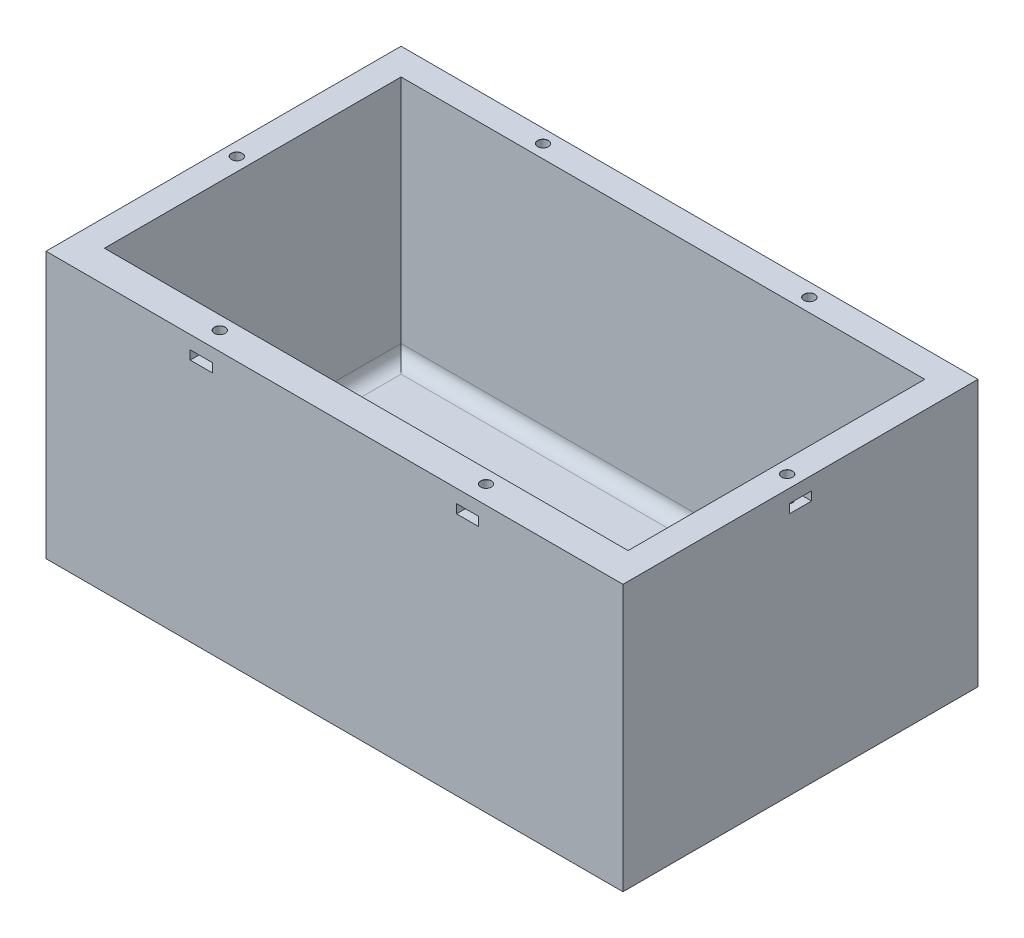
from build123d import *

# Parameters (mm, degrees)
SKIZZE1_W                                  = 130
SKIZZE1_H                                  = 80
AUFSATZ_LINEAR_AUSTRAGEN1_DEPTH            = 60
SKIZZE2_W                                  = 118
SKIZZE2_H                                  = 66.841692054
SCHNITT_LINEAR_AUSTRAGEN1_DEPTH            = 55
SKIZZE3_W                                  = 15.6
SKIZZE3_H                                  = 20
AUFSATZ_LINEAR_AUSTRAGEN2_DEPTH            = 6.8
SCHNITT_LINEAR_START                       = -20
SCHNITT_LINEAR_AUSTRAGEN10_DEPTH           = 20
SCHNITT_LINEAR_AUSTRAGEN11_DEPTH           = 20
SKIZZE16_W                                 = 15.6
SKIZZE16_H                                 = 20
AUFSATZ_LINEAR_AUSTRAGEN3_DEPTH            = 6.8
SCHNITT_LINEAR_AUSTRAGEN12_DEPTH           = 20
SCHNITT_LINEAR_AUSTRAGEN13_DEPTH           = 20
SKIZZE21_W                                 = 30
SKIZZE21_H                                 = 20
SCHNITT_LINEAR_AUSTRAGEN14_DEPTH           = 10
SKIZZE23_W                                 = 3
SKIZZE23_H                                 = 6
SCHNITT_LINEAR_AUSTRAGEN16_DEPTH           = 8
SKIZZE24_W                                 = 3
SKIZZE24_H                                 = 6
SCHNITT_LINEAR_AUSTRAGEN17_DEPTH           = 8
F_3_4_3_4_DURCHMESSER_BOHRUNG2_D           = 3.4
F_3_4_3_4_DURCHMESSER_BOHRUNG2_DEPTH       = 10
F_3_4_3_4_DURCHMESSER_BOHRUNG2_CSINK_D     = 3.45
F_3_4_3_4_DURCHMESSER_BOHRUNG2_CSINK_ANGLE = 90
F_3_4_3_4_DURCHMESSER_BOHRUNG2_TIP         = 1.021463052
F_2_4_2_4_DURCHMESSER_BOHRUNG1_D           = 2.4
F_2_4_2_4_DURCHMESSER_BOHRUNG1_DEPTH       = 10
F_2_4_2_4_DURCHMESSER_BOHRUNG1_CSINK_D     = 2.45
F_2_4_2_4_DURCHMESSER_BOHRUNG1_CSINK_ANGLE = 90
F_2_4_2_4_DURCHMESSER_BOHRUNG1_TIP         = 0.721032743
SKIZZE33_W                                 = 5
SKIZZE33_H                                 = 2
SCHNITT_LINEAR_AUSTRAGEN18_DEPTH           = 5.5
SKIZZE22_W                                 = 30
SKIZZE22_H                                 = 20
SCHNITT_LINEAR_AUSTRAGEN19_DEPTH           = 34.5
F_3_4_3_4_DURCHMESSER_BOHRUNG3_D           = 3.4
F_3_4_3_4_DURCHMESSER_BOHRUNG3_DEPTH       = 10
F_3_4_3_4_DURCHMESSER_BOHRUNG3_CSINK_D     = 3.45
F_3_4_3_4_DURCHMESSER_BOHRUNG3_CSINK_ANGLE = 90
F_3_4_3_4_DURCHMESSER_BOHRUNG3_TIP         = 1.021463052
SKIZZE37_W                                 = 5
SKIZZE37_H                                 = 2
SCHNITT_LINEAR_AUSTRAGEN21_DEPTH           = 5.5
SKIZZE38_W                                 = 5
SKIZZE38_H                                 = 2
SCHNITT_LINEAR_AUSTRAGEN22_DEPTH           = 5.5
SKIZZE39_W                                 = 5
SKIZZE39_H                                 = 2
SCHNITT_LINEAR_AUSTRAGEN23_DEPTH           = 5.5
VERRUNDUNG3_R                              = 3


# Read off the part's stored shape, not the designer's step: Schnitt-Linear austragen10, Schnitt-Linear austragen11, Schnitt-Linear austragen12, Schnitt-Linear austragen13
with BuildPart() as part:
    # Skizze1 → Aufsatz-Linear austragen1 (new body)
    with BuildSketch(Plane(origin=(0, 0, 0), x_dir=(1, 0, 0), z_dir=(0, 1, 0))):
        with Locations((65, 38.841692054)):
            Rectangle(SKIZZE1_W, SKIZZE1_H)
    extrude(amount=AUFSATZ_LINEAR_AUSTRAGEN1_DEPTH)

    # Skizze2 → Schnitt-Linear austragen1 (cut)
    with BuildSketch(Plane(origin=(0, 60, 0), x_dir=(1, 0, 0), z_dir=(0, 1, 0))):
        with Locations((65, 39.420846027)):
            Rectangle(SKIZZE2_W, SKIZZE2_H)
    extrude(amount=-SCHNITT_LINEAR_AUSTRAGEN1_DEPTH, mode=Mode.SUBTRACT)

    # Skizze3 → Aufsatz-Linear austragen2 (add)
    with BuildSketch(Plane(origin=(0, 5, 0), x_dir=(1, 0, 0), z_dir=(0, 1, 0))):
        with Locations((57.2, 38.841692054)):
            Rectangle(SKIZZE3_W, SKIZZE3_H)
    extrude(amount=AUFSATZ_LINEAR_AUSTRAGEN2_DEPTH)

    # Schnitt-Linear austragen10 outline → Schnitt-Linear austragen10 (cut)
    with BuildSketch(Plane.XY.offset(-28.841692054).offset(SCHNITT_LINEAR_START)):
        Polygon((49.4, 5), (53.32598183, 11.8), (49.4, 11.8), align=None)
    extrude(amount=SCHNITT_LINEAR_AUSTRAGEN10_DEPTH, mode=Mode.SUBTRACT)

    # Schnitt-Linear austragen11 outline → Schnitt-Linear austragen11 (cut)
    with BuildSketch(Plane.XY.offset(-28.841692054).offset(SCHNITT_LINEAR_START)):
        Polygon((53.32598183, 11.8), (65, 5), (65, 11.8), align=None)
    extrude(amount=SCHNITT_LINEAR_AUSTRAGEN11_DEPTH, mode=Mode.SUBTRACT)

    # Skizze16 → Aufsatz-Linear austragen3 (add)
    with BuildSketch(Plane(origin=(0, 5, 0), x_dir=(1, 0, 0), z_dir=(0, 1, 0))):
        with Locations((72.8, 38.841692054)):
            Rectangle(SKIZZE16_W, SKIZZE16_H)
    extrude(amount=AUFSATZ_LINEAR_AUSTRAGEN3_DEPTH)

    # Schnitt-Linear austragen12 outline → Schnitt-Linear austragen12 (cut)
    with BuildSketch(Plane.XY.offset(-28.841692054).offset(SCHNITT_LINEAR_START)):
        Polygon((80.6, 11.8), (76.67401817, 11.8), (80.6, 5), align=None)
    extrude(amount=SCHNITT_LINEAR_AUSTRAGEN12_DEPTH, mode=Mode.SUBTRACT)

    # Schnitt-Linear austragen13 outline → Schnitt-Linear austragen13 (cut)
    with BuildSketch(Plane.XY.offset(-28.841692054).offset(SCHNITT_LINEAR_START)):
        Polygon((65, 5), (76.67401817, 11.8), (65, 11.8), align=None)
    extrude(amount=SCHNITT_LINEAR_AUSTRAGEN13_DEPTH, mode=Mode.SUBTRACT)

    # Skizze21 → Schnitt-Linear austragen14 (cut)
    with BuildSketch(Plane(origin=(0, 5, 0), x_dir=(1, 0, 0), z_dir=(0, 1, 0))):
        with Locations((95.6, 38.841692054)):
            Rectangle(SKIZZE21_W, SKIZZE21_H)
    extrude(amount=-SCHNITT_LINEAR_AUSTRAGEN14_DEPTH, mode=Mode.SUBTRACT)

    # Skizze23 → Schnitt-Linear austragen16 (cut)
    with BuildSketch(Plane(origin=(14.292377765, -24.536687899, 0), x_dir=(0.8640958560374116, 0.5033272807815734, 0), z_dir=(-0.5033272807815734, 0.8640958560374116, 0))):
        with Locations((66.882744729, 38.841692054)):
            Rectangle(SKIZZE23_W, SKIZZE23_H)
    extrude(amount=-SCHNITT_LINEAR_AUSTRAGEN16_DEPTH, mode=Mode.SUBTRACT)

    # Skizze24 → Schnitt-Linear austragen17 (cut)
    with BuildSketch(Plane(origin=(18.64160794, 32.003304383, 0), x_dir=(0.8640958560374131, -0.5033272807815709, 0), z_dir=(0.5033272807815709, 0.8640958560374132, 0))):
        with Locations((45.934845453, 38.841692054)):
            Rectangle(SKIZZE24_W, SKIZZE24_H)
    extrude(amount=-SCHNITT_LINEAR_AUSTRAGEN17_DEPTH, mode=Mode.SUBTRACT)

    # Ø3.4 (3.4) Durchmesser Bohrung2
    with Locations(Plane(origin=(62.615063509, 36.150823773, 0), x_dir=(0, 0, -1), z_dir=(0.8660254037844358, 0.5000000000000049, 0))):
        with Locations((38.841692054, -32.069872981)):
            CounterSinkHole(F_3_4_3_4_DURCHMESSER_BOHRUNG2_D / 2, F_3_4_3_4_DURCHMESSER_BOHRUNG2_CSINK_D / 2, depth=F_3_4_3_4_DURCHMESSER_BOHRUNG2_DEPTH, counter_sink_angle=F_3_4_3_4_DURCHMESSER_BOHRUNG2_CSINK_ANGLE)
            with Locations((0, 0, -(F_3_4_3_4_DURCHMESSER_BOHRUNG2_DEPTH + F_3_4_3_4_DURCHMESSER_BOHRUNG2_TIP / 2))):  # 118° drill point
                Cone(0, F_3_4_3_4_DURCHMESSER_BOHRUNG2_D / 2, F_3_4_3_4_DURCHMESSER_BOHRUNG2_TIP, mode=Mode.SUBTRACT)

    # Ø2.4 (2.4) Durchmesser Bohrung1
    with Locations(Plane(origin=(0, 60, 0), x_dir=(1, 0, 0), z_dir=(0, 1, 0))):
        with Locations((127, 38.841692054), (95, 75.841692054), (35, 75.841692054), (35, 3), (95, 3), (3, 38.841692054), (132.023901178, -13.702298919)):
            CounterSinkHole(F_2_4_2_4_DURCHMESSER_BOHRUNG1_D / 2, F_2_4_2_4_DURCHMESSER_BOHRUNG1_CSINK_D / 2, depth=F_2_4_2_4_DURCHMESSER_BOHRUNG1_DEPTH, counter_sink_angle=F_2_4_2_4_DURCHMESSER_BOHRUNG1_CSINK_ANGLE)
            with Locations((0, 0, -(F_2_4_2_4_DURCHMESSER_BOHRUNG1_DEPTH + F_2_4_2_4_DURCHMESSER_BOHRUNG1_TIP / 2))):  # 118° drill point
                Cone(0, F_2_4_2_4_DURCHMESSER_BOHRUNG1_D / 2, F_2_4_2_4_DURCHMESSER_BOHRUNG1_TIP, mode=Mode.SUBTRACT)

    # Skizze33 → Schnitt-Linear austragen18 (cut)
    with BuildSketch(Plane(origin=(0, 0, -78.841692054), x_dir=(-1, 0, 0), z_dir=(0, 0, -1))):
        with Locations((-95, 56)):
            Rectangle(SKIZZE33_W, SKIZZE33_H)
        with Locations((-35, 56)):
            Rectangle(SKIZZE33_W, SKIZZE33_H)
    extrude(amount=-SCHNITT_LINEAR_AUSTRAGEN18_DEPTH, mode=Mode.SUBTRACT)

    # Skizze22 → Schnitt-Linear austragen19 (cut)
    with BuildSketch(Plane(origin=(0, 5, 0), x_dir=(1, 0, 0), z_dir=(0, 1, 0))):
        with Locations((34.4, 38.841692054)):
            Rectangle(SKIZZE22_W, SKIZZE22_H)
    extrude(amount=-SCHNITT_LINEAR_AUSTRAGEN19_DEPTH, mode=Mode.SUBTRACT)

    # Ø3.4 (3.4) Durchmesser Bohrung3
    with Locations(Plane(origin=(34.884936491, -20.140827473, 0), x_dir=(0, 0, 1), z_dir=(-0.8660254037844404, 0.49999999999999695, 0))):
        with Locations((-38.841692054, 32.930127019)):
            CounterSinkHole(F_3_4_3_4_DURCHMESSER_BOHRUNG3_D / 2, F_3_4_3_4_DURCHMESSER_BOHRUNG3_CSINK_D / 2, depth=F_3_4_3_4_DURCHMESSER_BOHRUNG3_DEPTH, counter_sink_angle=F_3_4_3_4_DURCHMESSER_BOHRUNG3_CSINK_ANGLE)
            with Locations((0, 0, -(F_3_4_3_4_DURCHMESSER_BOHRUNG3_DEPTH + F_3_4_3_4_DURCHMESSER_BOHRUNG3_TIP / 2))):  # 118° drill point
                Cone(0, F_3_4_3_4_DURCHMESSER_BOHRUNG3_D / 2, F_3_4_3_4_DURCHMESSER_BOHRUNG3_TIP, mode=Mode.SUBTRACT)

    # Skizze37 → Schnitt-Linear austragen21 (cut)
    with BuildSketch(Plane.XY.offset(1.158307946)):
        with Locations((35, 56)):
            Rectangle(SKIZZE37_W, SKIZZE37_H)
        with Locations((95, 56)):
            Rectangle(SKIZZE37_W, SKIZZE37_H)
    extrude(amount=-SCHNITT_LINEAR_AUSTRAGEN21_DEPTH, mode=Mode.SUBTRACT)

    # Skizze38 → Schnitt-Linear austragen22 (cut)
    with BuildSketch(Plane(origin=(130, 0, 0), x_dir=(0, 0, -1), z_dir=(1, 0, 0))):
        with Locations((38.841692054, 56)):
            Rectangle(SKIZZE38_W, SKIZZE38_H)
    extrude(amount=-SCHNITT_LINEAR_AUSTRAGEN22_DEPTH, mode=Mode.SUBTRACT)

    # Skizze39 → Schnitt-Linear austragen23 (cut)
    with BuildSketch(Plane.ZY):
        with Locations((-38.841692054, 56)):
            Rectangle(SKIZZE39_W, SKIZZE39_H)
    extrude(amount=-SCHNITT_LINEAR_AUSTRAGEN23_DEPTH, mode=Mode.SUBTRACT)

    # Verrundung3
    verrundung3_edges = [part.edges().sort_by_distance(p)[0] for p in [
        (6, 5, -39.420846027),
        (65, 5, -72.841692054),
        (124, 5, -39.420846027),
        (65, 5, -6),
    ]]
    fillet(verrundung3_edges, radius=VERRUNDUNG3_R)


solid = part.part
